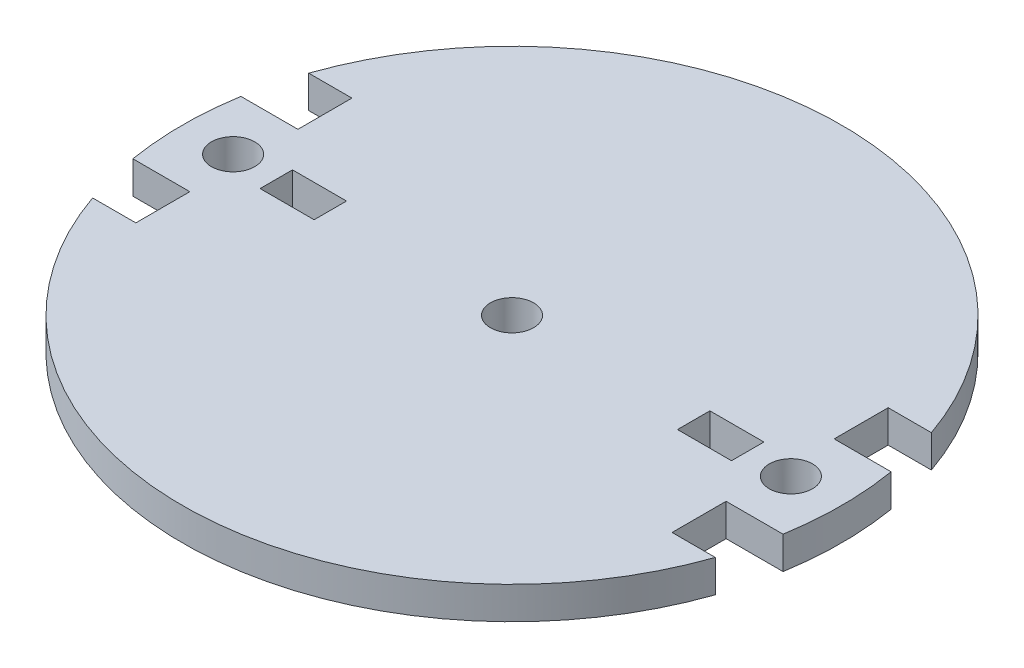
from build123d import *

# Parameters (mm, degrees)
CROQUIS1_R              = 30.5
SALIENTE_EXTRUIR1_DEPTH = 3
CROQUIS2_R              = 2
CORTAR_EXTRUIR1_DEPTH   = 4
CORTAR_EXTRUIR3_START   = -4
CORTAR_EXTRUIR3_DEPTH   = 4
CROQUIS6_W              = 5
CROQUIS6_H              = 3
CORTAR_EXTRUIR4_DEPTH   = 4
CROQUIS7_R              = 2
CORTAR_EXTRUIR5_DEPTH   = 4


with BuildPart() as part:
    # Croquis1 → Saliente-Extruir1 (new body)
    with BuildSketch(Plane(origin=(0, 0, 0), x_dir=(1, 0, 0), z_dir=(0, 1, 0))):
        Circle(CROQUIS1_R)
    extrude(amount=SALIENTE_EXTRUIR1_DEPTH)

    # Croquis2 → Cortar-Extruir1 (cut)
    with BuildSketch(Plane(origin=(0, 3, 0), x_dir=(1, 0, 0), z_dir=(0, 1, 0))):
        Circle(CROQUIS2_R)
    extrude(amount=-CORTAR_EXTRUIR1_DEPTH, mode=Mode.SUBTRACT)

    # Croquis5 → Cortar-Extruir3 (cut)
    with BuildSketch(Plane(origin=(0, 3, 0), x_dir=(1, 0, 0), z_dir=(0, 1, 0)).offset(CORTAR_EXTRUIR3_START)):
        with BuildLine():
            Line((30.087372767, -5), (24.814059068, -5))
            Line((24.814059068, -5), (24.814059068, -10))
            Line((24.814059068, -10), (28.814059068, -10))
            ThreePointArc((28.814059068, -10), (29.556634924, -7.526973624), (30.087372767, -5))
        make_face()
        with BuildLine():
            Line((24.814059068, 5), (30.087372767, 5))
            ThreePointArc((30.087372767, 5), (29.556634924, 7.526973624), (28.814059068, 10))
            Line((28.814059068, 10), (24.814059068, 10))
            Line((24.814059068, 10), (24.814059068, 5))
        make_face()
        with BuildLine():
            ThreePointArc((-30.087372767, -5), (-29.556634924, -7.526973624), (-28.814059068, -10))
            Line((-28.814059068, -10), (-24.814059068, -10))
            Line((-24.814059068, -10), (-24.814059068, -5))
            Line((-24.814059068, -5), (-30.087372767, -5))
        make_face()
        with BuildLine():
            Line((-24.814059068, 10), (-28.814059068, 10))
            ThreePointArc((-28.814059068, 10), (-29.556634924, 7.526973624), (-30.087372767, 5))
            Line((-30.087372767, 5), (-24.814059068, 5))
            Line((-24.814059068, 5), (-24.814059068, 10))
        make_face()
    extrude(amount=CORTAR_EXTRUIR3_DEPTH, mode=Mode.SUBTRACT)

    # Croquis6 → Cortar-Extruir4 (cut)
    with BuildSketch(Plane(origin=(0, 3, 0), x_dir=(1, 0, 0), z_dir=(0, 1, 0))):
        with Locations((19.314059068, 0)):
            Rectangle(CROQUIS6_W, CROQUIS6_H)
        with Locations((-19.314059068, 0)):
            Rectangle(CROQUIS6_W, CROQUIS6_H)
    extrude(amount=-CORTAR_EXTRUIR4_DEPTH, mode=Mode.SUBTRACT)

    # Croquis7 → Cortar-Extruir5 (cut)
    with BuildSketch(Plane(origin=(0, 3, 0), x_dir=(1, 0, 0), z_dir=(0, 1, 0))):
        with Locations((-25.814059068, 0)):
            Circle(CROQUIS7_R)
        with Locations((25.814059068, 0)):
            Circle(CROQUIS7_R)
    extrude(amount=-CORTAR_EXTRUIR5_DEPTH, mode=Mode.SUBTRACT)


solid = part.part
